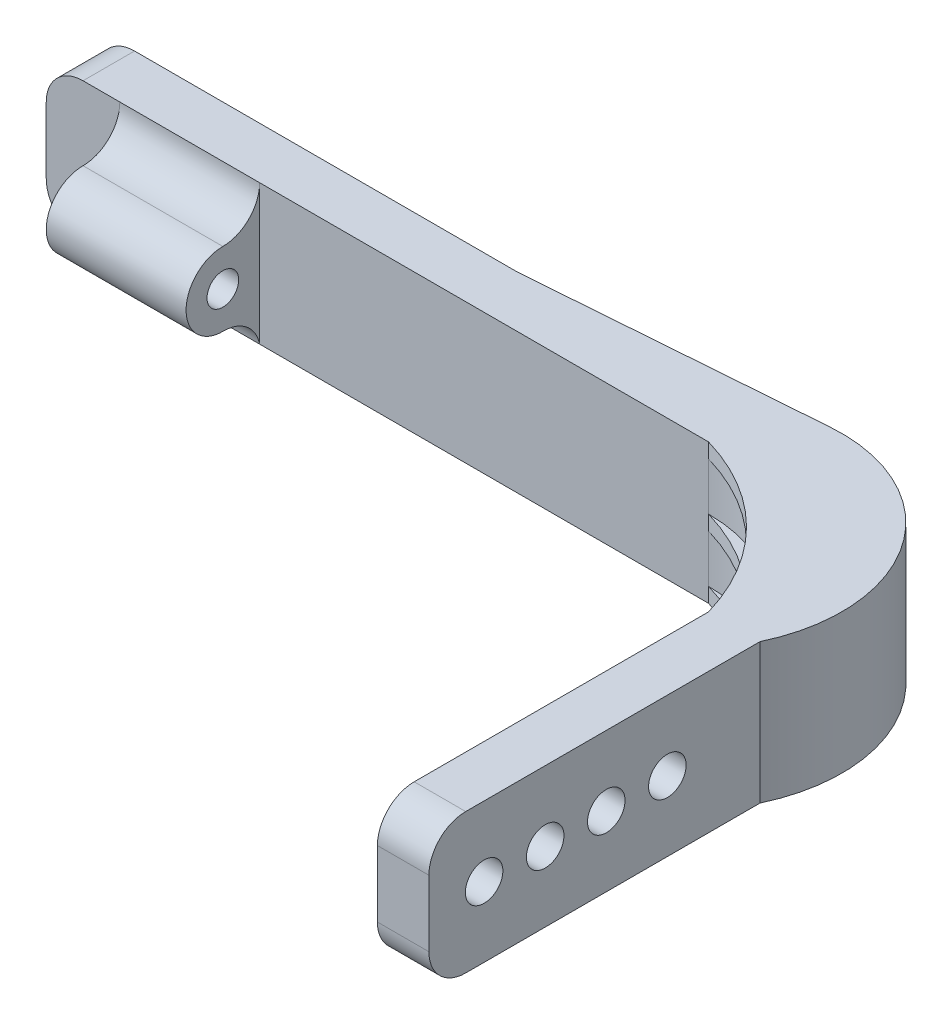
from build123d import *

# Parameters (mm, degrees)
BOSS_EXTRUDE1_DEPTH = 19
SKETCH4_R           = 2.55
CUT_EXTRUDE1_DEPTH  = 139.686697271
LPATTERN1_COUNT     = 4
LPATTERN1_PITCH     = 8.3
FILLET2_R           = 5
BOSS_EXTRUDE4_DEPTH = 19
BOSS_EXTRUDE5_DEPTH = 2
LPATTERN3_COUNT     = 3
LPATTERN3_PITCH     = 8.5
FILLET4_R           = 20
SKETCH9_R           = 2.15
BOSS_EXTRUDE6_DEPTH = 19
FILLET5_R           = 5


with BuildPart() as part:
    # Sketch1 → Boss-Extrude1 (new body)
    with BuildSketch(Plane(origin=(0, 0, 0), x_dir=(1, 0, 0), z_dir=(0, 1, 0))):
        with BuildLine():
            Line((0, 0), (90, 0))
            ThreePointArc((90, 0), (109.091883092, -7.908116908), (117, -27))
            Line((117, -27), (117, -72))
            Line((117, -72), (110, -72))
            Line((110, -72), (110, -27))
            ThreePointArc((110, -27), (104.142135624, -12.857864376), (90, -7))
            Line((90, -7), (0, -7))
            Line((0, -7), (0, 0))
        make_face()
    extrude(amount=BOSS_EXTRUDE1_DEPTH)

    # Sketch4 → Cut-Extrude1 (cut, through all)
    with BuildSketch(Plane(origin=(0, 0, 0), x_dir=(0, 0, -1), z_dir=(1, 0, 0))):
        with Locations(Location((-64.5, 9.5, 0), (0, 0, 180))):
            Circle(SKETCH4_R)
    cut_extrude1 = extrude(amount=CUT_EXTRUDE1_DEPTH, mode=Mode.SUBTRACT)

    # LPattern1: Cut-Extrude1 ×4
    with Locations(*[(0, 0, -i * LPATTERN1_PITCH) for i in range(1, LPATTERN1_COUNT)]):
        add(cut_extrude1, mode=Mode.SUBTRACT)

    # Fillet2
    fillet2_edges = [part.edges().sort_by_distance(p)[0] for p in [
        (0, 0, 3.5),
        (113.5, 19, 72),
        (0, 19, 3.5),
        (113.5, 0, 72),
    ]]
    fillet(fillet2_edges, radius=FILLET2_R)

    # Sketch6 → Boss-Extrude4 (add)
    with BuildSketch(Plane(origin=(0, 0, 0), x_dir=(1, 0, 0), z_dir=(0, 1, 0))):
        with BuildLine():
            Line((57.067989457, 0), (96.460545107, 3))
            ThreePointArc((96.460545107, 3), (115.383129249, -6.075834674), (117, -27))
            ThreePointArc((117, -27), (109.091883092, -7.908116908), (90, 0))
            Line((90, 0), (57.067989457, 0))
        make_face()
    extrude(amount=BOSS_EXTRUDE4_DEPTH)

    # Sketch8 → Boss-Extrude5 (add)
    with BuildSketch(Plane(origin=(0, 0, 0), x_dir=(1, 0, 0), z_dir=(0, 1, 0))):
        with BuildLine():
            ThreePointArc((90, -7), (102.578584062, -14.421415938), (110, -27))
            ThreePointArc((110, -27), (104.142135624, -12.857864376), (90, -7))
        make_face()
    boss_extrude5 = extrude(amount=BOSS_EXTRUDE5_DEPTH)

    # LPattern3: Boss-Extrude5 ×3
    with Locations(*[(0, i * LPATTERN3_PITCH, 0) for i in range(1, LPATTERN3_COUNT)]):
        add(boss_extrude5)

    # Fillet4
    # the kernel refuses this fillet: 20 mm, written as the material it adds along each edge
    with BuildSketch(Plane(origin=(57.067989457, 0, 0), x_dir=(-1, 0, 0), z_dir=(0, 1, 0))) as fillet4_piece_1:
        with BuildLine():
            CenterArc((FILLET4_R * 0.0380232084134, -FILLET4_R), FILLET4_R, 90, 4.355040752)
            Line((-FILLET4_R * 0.0379134219382, -FILLET4_R * 0.00288735432207), (0, 0))
            Line((0, 0), (FILLET4_R * 0.0380232084134, 0))
        make_face()
    extrude(amount=19)

    # Sketch9 → Boss-Extrude6 (add)
    with BuildSketch(Plane.ZY.offset(-10)):
        with BuildLine():
            Line((7, 14), (12, 14))
            ThreePointArc((12, 14), (17, 9), (12, 4))
            Line((12, 4), (7, 4))
            Line((7, 4), (7, 14))
        make_face()
        with Locations((12, 9)):
            Circle(SKETCH9_R, mode=Mode.SUBTRACT)
    extrude(amount=-BOSS_EXTRUDE6_DEPTH)

    # Fillet5
    # the kernel refuses this fillet: 5 mm, written as the material it adds along each edge
    with BuildSketch(Plane(origin=(10, 4, 7), x_dir=(0, -1.0, 1.5822898546952626e-12), z_dir=(1, 0, 0))) as fillet5_piece_1:
        with BuildLine():
            CenterArc((5, -4.898979486), FILLET5_R, 101.536959033, 78.463040967)
            Line((0, -4.898979486), (0, 0))
            Line((0, 0), (4, 0))
        make_face()
    extrude(amount=19)
    with BuildSketch(Plane(origin=(10, 14, 7), x_dir=(0, 1, 0), z_dir=(1, 0, 0))) as fillet5_piece_2:
        with BuildLine():
            CenterArc((FILLET5_R, FILLET5_R), FILLET5_R, 180, 90)
            Line((0, FILLET5_R), (0, 0))
            Line((0, 0), (FILLET5_R, 0))
        make_face()
    extrude(amount=19)


solid = part.part
